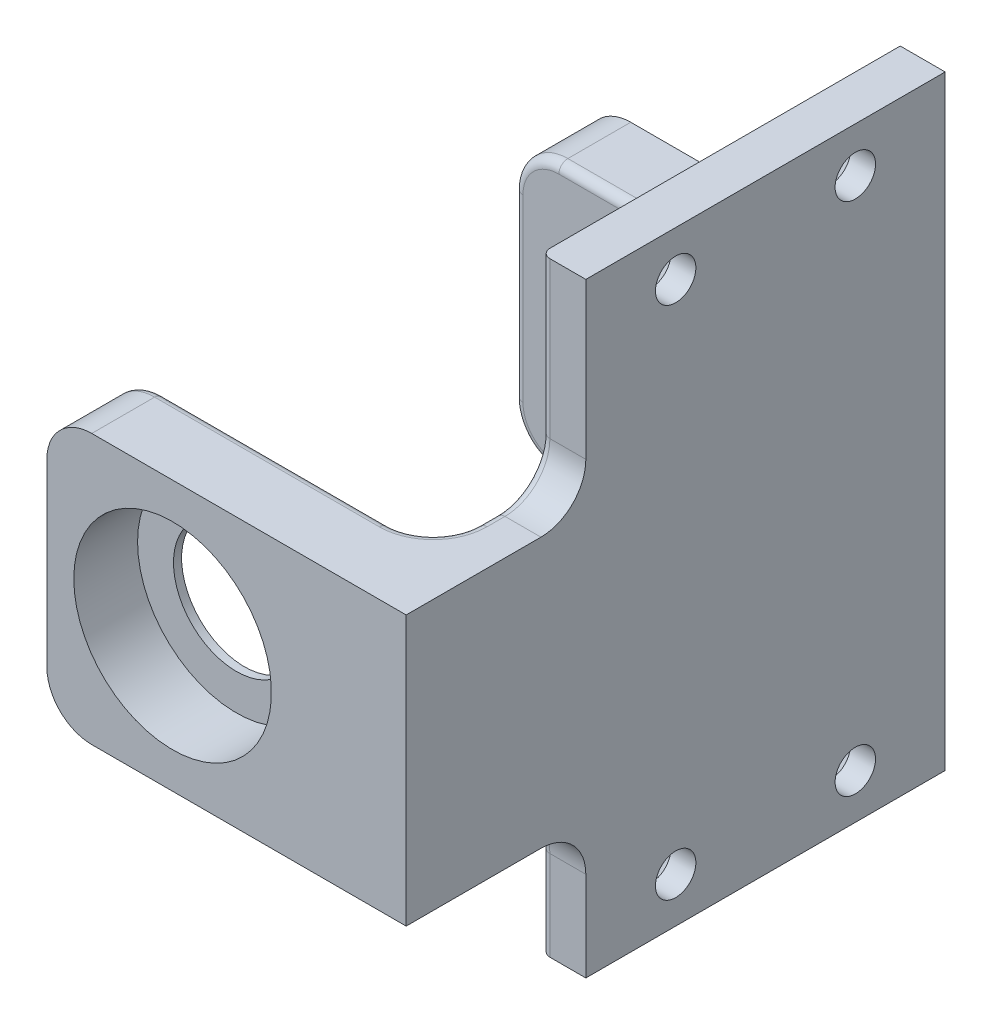
from build123d import *

# Parameters (mm, degrees)
BOSS_EXTRUDE1_DEPTH           = 15
BOSS_EXTRUDE2_DEPTH           = 5
SKETCH3_R                     = 11
CUT_EXTRUDE1_DEPTH            = 7.1
CUT_EXTRUDE2_REACH            = 75.61
SKETCH4_R                     = 7
FILLET1_R                     = 5
FILLET2_R                     = 5
FILLET3_R                     = 1
FILLET6_START                 = -30
FILLET6_DEPTH                 = 6.9999999
FILLET6_2_ANGLE               = 90
FILLET6_3_ANGLE               = 90
CSK_FOR_M4_SFHCS1_D           = 4.5
CSK_FOR_M4_SFHCS1_CSINK_D     = 8.96
CSK_FOR_M4_SFHCS1_CSINK_ANGLE = 90


with BuildPart() as part:
    # Sketch2 → Boss-Extrude1 (new, symmetric)
    with BuildSketch(Plane(origin=(0, 0, 0), x_dir=(1, 0, 0), z_dir=(0, 1, 0))):
        Polygon((-35, 22), (0, 22), (0, -22), (-35, -22), (-35, -30), (5, -30), (5, 30), (-35, 30), align=None)
    extrude(amount=BOSS_EXTRUDE1_DEPTH, both=True)

    # Sketch5 → Boss-Extrude2 (add)
    with BuildSketch(Plane(origin=(5, 0, 0), x_dir=(0, 0, -1), z_dir=(1, 0, 0))):
        Polygon((-10, 37.35), (30, 37.35), (30, -30), (-10, -30), (-10, -15), (-30, -15), (-30, 15), (-10, 15), align=None)
    extrude(amount=-BOSS_EXTRUDE2_DEPTH)

    # Sketch3 → Cut-Extrude1 (cut)
    with BuildSketch(Plane(origin=(0, 0, -30), x_dir=(-1, 0, 0), z_dir=(0, 0, -1))):
        with Locations((21, 0)):
            Circle(SKETCH3_R)
    cut_extrude1 = extrude(amount=-CUT_EXTRUDE1_DEPTH, mode=Mode.SUBTRACT)

    # Sketch4 → Cut-Extrude2 (cut, up to next)
    with BuildSketch(Plane(origin=(0, 0, -22.9), x_dir=(-1, 0, 0), z_dir=(0, 0, -1)), mode=Mode.PRIVATE) as cut_extrude2_sk1:
        with Locations((21, 0)):
            Circle(SKETCH4_R)
    cut_extrude2_tool1 = extrude(cut_extrude2_sk1.sketch, amount=-CUT_EXTRUDE2_REACH, mode=Mode.PRIVATE) & part.part
    cut_extrude2 = cut_extrude2_tool1.solids().sort_by_distance((-21, 0, -22.9))[0]
    add(cut_extrude2, mode=Mode.SUBTRACT)

    # Mirror1: Cut-Extrude1, Cut-Extrude2 across plane
    add(cut_extrude1.mirror(Plane.XY), mode=Mode.SUBTRACT)
    add(cut_extrude2.mirror(Plane.XY), mode=Mode.SUBTRACT)

    # Fillet1
    fillet1_edges = [part.edges().sort_by_distance(p)[0] for p in [
        (0, 0, 22),
        (0, 0, -22),
    ]]
    fillet(fillet1_edges, radius=FILLET1_R)

    # Fillet2
    fillet2_edges = [part.edges().sort_by_distance(p)[0] for p in [
        (-35, -15, -26),
        (-35, 15, 26),
        (2.5, -15, 10),
        (2.5, 15, 10),
        (-35, 15, -26),
        (-35, -15, 26),
    ]]
    fillet(fillet2_edges, radius=FILLET2_R)

    # Fillet3
    # the kernel refuses this fillet: 1 mm, written as the material it takes off along each edge
    with BuildSketch(Plane(origin=(-5, 15, 17), x_dir=(1, 0, 0), z_dir=(0, 0, -1))) as fillet3_piece_1:
        with BuildLine():
            CenterArc((5 + FILLET3_R, FILLET3_R), FILLET3_R, 180, 90)
            Line((5 + FILLET3_R, 0), (5, 0))
            Line((5, 0), (5, FILLET3_R))
        make_face()
    revolve(axis=Axis((-5, 15, 17), (0, -1, 0)), revolution_arc=90, mode=Mode.SUBTRACT)
    with BuildSketch(Plane(origin=(-5, 15, -17), x_dir=(0, 0, -1), z_dir=(-1, 0, 0))) as fillet3_piece_2_section:
        with BuildLine():
            CenterArc((5 + FILLET3_R, FILLET3_R), FILLET3_R, 180, 90)
            Line((5 + FILLET3_R, 0), (5, 0))
            Line((5, 0), (5, FILLET3_R))
        make_face()
    fillet3_piece_2 = revolve(axis=Axis((-5, 15, -17), (0, -1, 0)), revolution_arc=138.720976341, mode=Mode.PRIVATE)
    fillet3_piece_2 = split(fillet3_piece_2, bisect_by=Plane(origin=(0, 15, -17), z_dir=(-1, 0, 0)), keep=Keep.TOP, mode=Mode.PRIVATE)
    add(fillet3_piece_2, mode=Mode.SUBTRACT)
    with BuildSketch(Plane(origin=(-30, 15, -22), x_dir=(0, -1, 0), z_dir=(1, 0, 0)), Plane(origin=(-5, -15, 22), x_dir=(0, 0, 1), z_dir=(-1, 0, 0))) as fillet3_piece_3:
        with BuildLine():
            CenterArc((FILLET3_R, FILLET3_R), FILLET3_R, 180, 90)
            Line((0, FILLET3_R), (0, 0))
            Line((0, 0), (FILLET3_R, 0))
        make_face()
    extrude(amount=25, mode=Mode.SUBTRACT)
    with BuildSketch(Plane(origin=(-30, 10, -22), x_dir=(0, 1, 0), z_dir=(1, 0, 0))) as fillet3_piece_4:
        with BuildLine():
            CenterArc((5 - FILLET3_R, -FILLET3_R), FILLET3_R, 0, 90)
            Line((5, -FILLET3_R), (5, 0))
            Line((5, 0), (5 - FILLET3_R, 0))
        make_face()
    revolve(axis=Axis((-30, 10, -22), (0, 0, 1)), revolution_arc=90, mode=Mode.SUBTRACT)
    with BuildSketch(Plane(origin=(-35, 10, -22), x_dir=(1, 0, 0), z_dir=(0, -1, 0)), Plane(origin=(-35, -10, 22), x_dir=(1, 0, 0), z_dir=(0, 1, 0))) as fillet3_piece_5:
        with BuildLine():
            CenterArc((FILLET3_R, -FILLET3_R), FILLET3_R, 90, 90)
            Line((0, -FILLET3_R), (0, 0))
            Line((0, 0), (FILLET3_R, 0))
        make_face()
    extrude(amount=20, mode=Mode.SUBTRACT)
    with BuildSketch(Plane(origin=(-30, -10, -22), x_dir=(-1, 0, 0), z_dir=(0, 1, 0))) as fillet3_piece_6:
        with BuildLine():
            CenterArc((5 - FILLET3_R, -FILLET3_R), FILLET3_R, 0, 90)
            Line((5, -FILLET3_R), (5, 0))
            Line((5, 0), (5 - FILLET3_R, 0))
        make_face()
    revolve(axis=Axis((-30, -10, -22), (0, 0, 1)), revolution_arc=90, mode=Mode.SUBTRACT)
    with BuildSketch(Plane(origin=(-30, -15, -22), x_dir=(0, 1, 0), z_dir=(1, 0, 0)), Plane(origin=(-5, 15, 22), x_dir=(0, 0, 1), z_dir=(-1, 0, 0))) as fillet3_piece_7:
        with BuildLine():
            CenterArc((FILLET3_R, -FILLET3_R), FILLET3_R, 90, 90)
            Line((0, -FILLET3_R), (0, 0))
            Line((0, 0), (FILLET3_R, 0))
        make_face()
    extrude(amount=25, mode=Mode.SUBTRACT)
    with BuildSketch(Plane(origin=(-5, -15, -17), x_dir=(0, 0, -1), z_dir=(-1, 0, 0))) as fillet3_piece_8_section:
        with BuildLine():
            CenterArc((5 + FILLET3_R, -FILLET3_R), FILLET3_R, 90, 90)
            Line((5, -FILLET3_R), (5, 0))
            Line((5, 0), (5 + FILLET3_R, 0))
        make_face()
    fillet3_piece_8 = revolve(axis=Axis((-5, -15, -17), (0, -1, 0)), revolution_arc=138.720976341, mode=Mode.PRIVATE)
    fillet3_piece_8 = split(fillet3_piece_8, bisect_by=Plane(origin=(0, -15, -17), z_dir=(-1, 0, 0)), keep=Keep.TOP, mode=Mode.PRIVATE)
    add(fillet3_piece_8, mode=Mode.SUBTRACT)
    with BuildSketch(Plane(origin=(-5, -15, 17), x_dir=(1, 0, 0), z_dir=(0, 0, -1))) as fillet3_piece_9:
        with BuildLine():
            CenterArc((5 + FILLET3_R, -FILLET3_R), FILLET3_R, 90, 90)
            Line((5, -FILLET3_R), (5, 0))
            Line((5, 0), (5 + FILLET3_R, 0))
        make_face()
    revolve(axis=Axis((-5, -15, 17), (0, -1, 0)), revolution_arc=90, mode=Mode.SUBTRACT)
    with BuildSketch(Plane(origin=(-30, -10, 22), x_dir=(0, -1, 0), z_dir=(1, 0, 0))) as fillet3_piece_10:
        with BuildLine():
            CenterArc((5 - FILLET3_R, -FILLET3_R), FILLET3_R, 0, 90)
            Line((5, -FILLET3_R), (5, 0))
            Line((5, 0), (5 - FILLET3_R, 0))
        make_face()
    revolve(axis=Axis((-30, -10, 22), (0, 0, -1)), revolution_arc=90, mode=Mode.SUBTRACT)
    with BuildSketch(Plane(origin=(-30, 10, 22), x_dir=(0, 1, 0), z_dir=(1, 0, 0))) as fillet3_piece_11:
        with BuildLine():
            CenterArc((5 - FILLET3_R, FILLET3_R), FILLET3_R, 270, 90)
            Line((5, FILLET3_R), (5, 0))
            Line((5, 0), (5 - FILLET3_R, 0))
        make_face()
    revolve(axis=Axis((-30, 10, 22), (0, 0, 1)), revolution_arc=90, mode=Mode.SUBTRACT)
    with BuildSketch(Plane(origin=(0, 15, 15), x_dir=(0, -1, 0), z_dir=(0, 0, 1))) as fillet3_piece_12:
        with BuildLine():
            CenterArc((FILLET3_R, FILLET3_R), FILLET3_R, 180, 90)
            Line((0, FILLET3_R), (0, 0))
            Line((0, 0), (FILLET3_R, 0))
        make_face()
    extrude(amount=2, mode=Mode.SUBTRACT)
    with BuildSketch(Plane(origin=(0, -15, 15), x_dir=(0, 1, 0), z_dir=(0, 0, 1))) as fillet3_piece_13:
        with BuildLine():
            CenterArc((FILLET3_R, -FILLET3_R), FILLET3_R, 90, 90)
            Line((0, -FILLET3_R), (0, 0))
            Line((0, 0), (FILLET3_R, 0))
        make_face()
    extrude(amount=2, mode=Mode.SUBTRACT)
    with BuildSketch(Plane(origin=(0, 20, 10), x_dir=(0, 0, -1), z_dir=(0, 1, 0))) as fillet3_piece_14:
        with BuildLine():
            CenterArc((FILLET3_R, -FILLET3_R), FILLET3_R, 90, 90)
            Line((0, -FILLET3_R), (0, 0))
            Line((0, 0), (FILLET3_R, 0))
        make_face()
    extrude(amount=19.85, mode=Mode.SUBTRACT)
    with BuildSketch(Plane(origin=(0, 20, 15), x_dir=(0, -1, 0), z_dir=(0, 0, 1))) as fillet3_piece_15:
        with BuildLine():
            CenterArc((5 + FILLET3_R, FILLET3_R), FILLET3_R, 180, 90)
            Line((5, FILLET3_R), (5, 0))
            Line((5, 0), (5 + FILLET3_R, 0))
        make_face()
    revolve(axis=Axis((0, 20, 15), (1, 0, 0)), revolution_arc=90, mode=Mode.SUBTRACT)
    with BuildSketch(Plane(origin=(0, -32.5, 10), x_dir=(0, 0, -1), z_dir=(0, 1, 0))) as fillet3_piece_16:
        with BuildLine():
            CenterArc((FILLET3_R, -FILLET3_R), FILLET3_R, 90, 90)
            Line((0, -FILLET3_R), (0, 0))
            Line((0, 0), (FILLET3_R, 0))
        make_face()
    extrude(amount=12.5, mode=Mode.SUBTRACT)
    with BuildSketch(Plane(origin=(0, -20, 15), x_dir=(0, 0, -1), z_dir=(0, -1, 0))) as fillet3_piece_17:
        with BuildLine():
            CenterArc((5 + FILLET3_R, FILLET3_R), FILLET3_R, 180, 90)
            Line((5, FILLET3_R), (5, 0))
            Line((5, 0), (5 + FILLET3_R, 0))
        make_face()
    revolve(axis=Axis((0, -20, 15), (1, 0, 0)), revolution_arc=90, mode=Mode.SUBTRACT)

    # Fillet6: read off the stored shape, not the designer's step
    # Fillet6 outline → Fillet6 (add)
    with BuildSketch(Plane.XY.offset(FILLET6_START)):
        with BuildLine():
            Line((-5, 15), (0, 15))
            Line((0, 15), (0, 20))
            ThreePointArc((0, 20), (-1.464466094, 16.464466094), (-5, 15))
        make_face()
        with BuildLine():
            ThreePointArc((-5, -15), (-1.464466094, -16.464466094), (0, -20))
            Line((0, -20), (0, -15))
            Line((0, -15), (-5, -15))
        make_face()
    extrude(amount=FILLET6_DEPTH)

    # Fillet6 2 outline → Fillet6 2 (revolve)
    with BuildSketch(Plane(origin=(0, -14, -23), x_dir=(0, 0, 1), z_dir=(0, 1, 0))):
        with BuildLine():
            ThreePointArc((1, -5), (2.464466094, -1.464466094), (6, 0))
            Line((6, 0), (1, 0))
            Line((1, 0), (1, -5))
        make_face()
    revolve(axis=Axis((0, -14, -23), (1, 0, 0)), revolution_arc=FILLET6_2_ANGLE)

    # Fillet6 3 outline → Fillet6 3 (revolve)
    with BuildSketch(Plane(origin=(0, 14, -23), x_dir=(0, 1, 0), z_dir=(0, 0, -1))):
        with BuildLine():
            ThreePointArc((1, -5), (2.464466094, -1.464466094), (6, 0))
            Line((6, 0), (1, 0))
            Line((1, 0), (1, -5))
        make_face()
    revolve(axis=Axis((0, 14, -23), (1, 0, 0)), revolution_arc=FILLET6_3_ANGLE)

    # CSK for M4 SFHCS1 (through all)
    with Locations(Plane.ZY):
        with Locations((0, 32.35), (-20, -25), (0, -25), (-20, 32.35)):
            CounterSinkHole(CSK_FOR_M4_SFHCS1_D / 2, CSK_FOR_M4_SFHCS1_CSINK_D / 2, counter_sink_angle=CSK_FOR_M4_SFHCS1_CSINK_ANGLE)


solid = part.part
